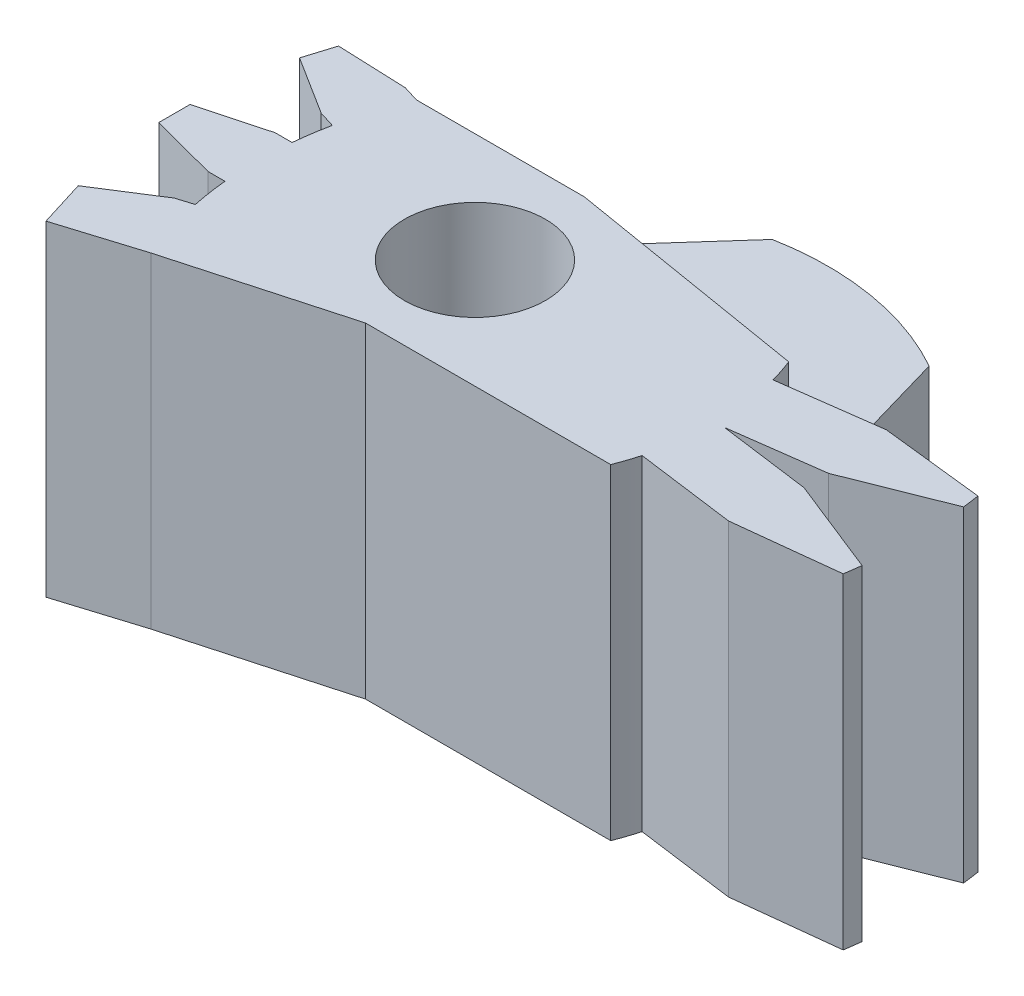
from build123d import *

# Parameters (mm, degrees)
BOSS_EXTRUDE1_DEPTH = 9.7
BOSS_EXTRUDE2_DEPTH = 5.8
CUT_EXTRUDE1_DEPTH  = 15.880557968
BOSS_EXTRUDE9_REACH = 16.881
BOSS_EXTRUDE8_START = -9.7
BOSS_EXTRUDE8_DEPTH = 9.7
BOSS_EXTRUDE5_DEPTH = 5.8
CUT_EXTRUDE2_DEPTH  = 9.7


# Read off the part's stored shape, not the designer's step: Boss-Extrude8
with BuildPart() as part:
    # Sketch1 → Boss-Extrude1 (new body)
    with BuildSketch(Plane(origin=(0, 0, 0), x_dir=(1, 0, 0), z_dir=(0, 1, 0))):
        Polygon((6.15, 2.65), (6.15, -2.65), (-1.15, -2.65), (-6.15, -4.038578044), (-6.15, 3.861421956), (-1.15, 3.861421956), align=None)
    extrude(amount=BOSS_EXTRUDE1_DEPTH)

    # Sketch2 → Boss-Extrude2 (add)
    with BuildSketch(Plane.XZ):
        Polygon((-6.15, -3.861421956), (-1.15, -9.461421956), (-1.15, -3.861421956), align=None)
        Polygon((-1.15, -3.861421956), (-1.15, -9.461421956), (4.45, -8.532111962), (4.45, -2.932111962), align=None)
        Polygon((4.45, -2.932111962), (4.45, -8.532111962), (6.15, -2.65), align=None)
    extrude(amount=-BOSS_EXTRUDE2_DEPTH)

    # Sketch3 → Cut-Extrude1 (cut, through all)
    with BuildSketch(Plane(origin=(0, 9.7, 0), x_dir=(1, 0, 0), z_dir=(0, 1, 0))):
        with BuildLine():
            ThreePointArc((0.95, 0.605710978), (0.33492424, 2.090635219), (-1.15, 2.705710978))
            Line((-1.15, 2.705710978), (-1.15, -1.494289022))
            ThreePointArc((-1.15, -1.494289022), (0.33492424, -0.879213262), (0.95, 0.605710978))
        make_face()
        with BuildLine():
            Line((-1.15, -1.494289022), (-1.15, 2.705710978))
            ThreePointArc((-1.15, 2.705710978), (-3.25, 0.605710978), (-1.15, -1.494289022))
        make_face()
    extrude(amount=-CUT_EXTRUDE1_DEPTH, mode=Mode.SUBTRACT)

    # Boss-Extrude9: up to this face of the body (flat: up to its plane)
    boss_extrude9_end = Plane(part.part.faces().sort_by_distance((0.174384558, 0, -2.694350329))[0])
    # Sketch4 → Boss-Extrude9 (add, up to the picked face)
    with BuildSketch(Plane(origin=(0, 9.7, 0), x_dir=(1, 0, 0), z_dir=(0, 1, 0)), mode=Mode.PRIVATE) as boss_extrude9_sk1:
        with BuildLine():
            Line((12.596453684, 0.767826071), (12.330020735, 2.75))
            Line((12.330020735, 2.75), (6.383498949, 1.950701151))
            ThreePointArc((6.383498949, 1.950701151), (6.27561663, 2.303311358), (6.15, 2.65))
            Line((6.15, 2.65), (6.15, -2.65))
            ThreePointArc((6.15, -2.65), (6.27561663, -2.303311358), (6.383498949, -1.950701151))
            Line((6.383498949, -1.950701151), (12.330020735, -2.75))
            Line((12.330020735, -2.75), (12.596453684, -0.767826071))
            Line((12.596453684, -0.767826071), (6.884079059, 0))
            Line((6.884079059, 0), (12.596453684, 0.767826071))
        make_face()
    boss_extrude9_tool1 = split(extrude(boss_extrude9_sk1.sketch, amount=-BOSS_EXTRUDE9_REACH, mode=Mode.PRIVATE), bisect_by=boss_extrude9_end, keep=Keep.BOTH, mode=Mode.PRIVATE)
    add(boss_extrude9_tool1.solids().sort_by(Axis((6.19524, 9.7, -2.276473), (0, -1, 0)))[0])

    # Boss-Extrude8 outline → Boss-Extrude8 (add)
    with BuildSketch(Plane(origin=(0, 9.7, 0), x_dir=(1, 0, 0), z_dir=(0, 1, 0)).offset(BOSS_EXTRUDE8_START)):
        with BuildLine():
            Line((-7.223773577, -2.277754847), (-8.969746456, -3.387643024))
            Line((-8.969746456, -3.387643024), (-8.537608436, -4.779743311))
            Line((-8.537608436, -4.779743311), (-6.15, -4.038578044))
            Line((-6.15, -4.038578044), (-6.15, 3.861421956))
            Line((-6.15, 3.861421956), (-6.627521687, 4.00965501))
            Line((-6.627521687, 4.00965501), (-8.696484144, 4.090781022))
            Line((-8.696484144, 4.090781022), (-8.971664943, 3.204306677))
            Line((-8.971664943, 3.204306677), (-7.220453901, 2.099568261))
            Line((-7.220453901, 2.099568261), (-6.742932214, 1.951335207))
            ThreePointArc((-6.742932214, 1.951335207), (-6.835256527, 1.433422288), (-6.900626431, 0.911421956))
            Line((-6.900626431, 0.911421956), (-7.405143495, 0.911421956))
            Line((-7.405143495, 0.911421956), (-9.400626431, 0.373036291))
            Line((-9.400626431, 0.373036291), (-9.400626431, -0.556661548))
            Line((-9.400626431, -0.556661548), (-7.401686619, -1.088575255))
            Line((-7.401686619, -1.088575255), (-6.900626431, -1.088578044))
            ThreePointArc((-6.900626431, -1.088578044), (-6.835256527, -1.610578376), (-6.742932214, -2.128491295))
            Line((-6.742932214, -2.128491295), (-7.223773577, -2.277754847))
        make_face()
    extrude(amount=BOSS_EXTRUDE8_DEPTH)

    # Sketch8 → Boss-Extrude5 (add)
    with BuildSketch(Plane(origin=(0, 5.8, 0), x_dir=(1, 0, 0), z_dir=(0, 1, 0))):
        with BuildLine():
            ThreePointArc((1.731854671, 9.490021268), (0.289677429, 9.601670434), (-1.15, 9.461421956))
            Line((-1.15, 9.461421956), (1.65, 8.996766959))
            Line((1.65, 8.996766959), (1.731854671, 9.490021268))
        make_face()
        with BuildLine():
            Line((1.731854671, 9.490021268), (1.65, 8.996766959))
            Line((1.65, 8.996766959), (4.45, 8.532111962))
            ThreePointArc((4.45, 8.532111962), (3.132791885, 9.12986067), (1.731854671, 9.490021268))
        make_face()
    extrude(amount=-BOSS_EXTRUDE5_DEPTH)

    # Sketch5 → Cut-Extrude2 (cut)
    with BuildSketch(Plane(origin=(0, 9.7, 0), x_dir=(1, 0, 0), z_dir=(0, 1, 0))):
        Polygon((9.623192791, 0.368176647), (12.596453684, 0.767826071), (12.496541328, 1.511141295), align=None)
        Polygon((9.356759842, 2.350350576), (12.429933091, 2.006684777), (12.330020735, 2.75), align=None)
        Polygon((12.429933091, -2.006684777), (12.330020735, -2.75), (9.356759842, -2.350350576), align=None)
        Polygon((12.596453684, -0.767826071), (12.496541328, -1.511141295), (9.623192791, -0.368176647), align=None)
    extrude(amount=-CUT_EXTRUDE2_DEPTH, mode=Mode.SUBTRACT)


solid = part.part
